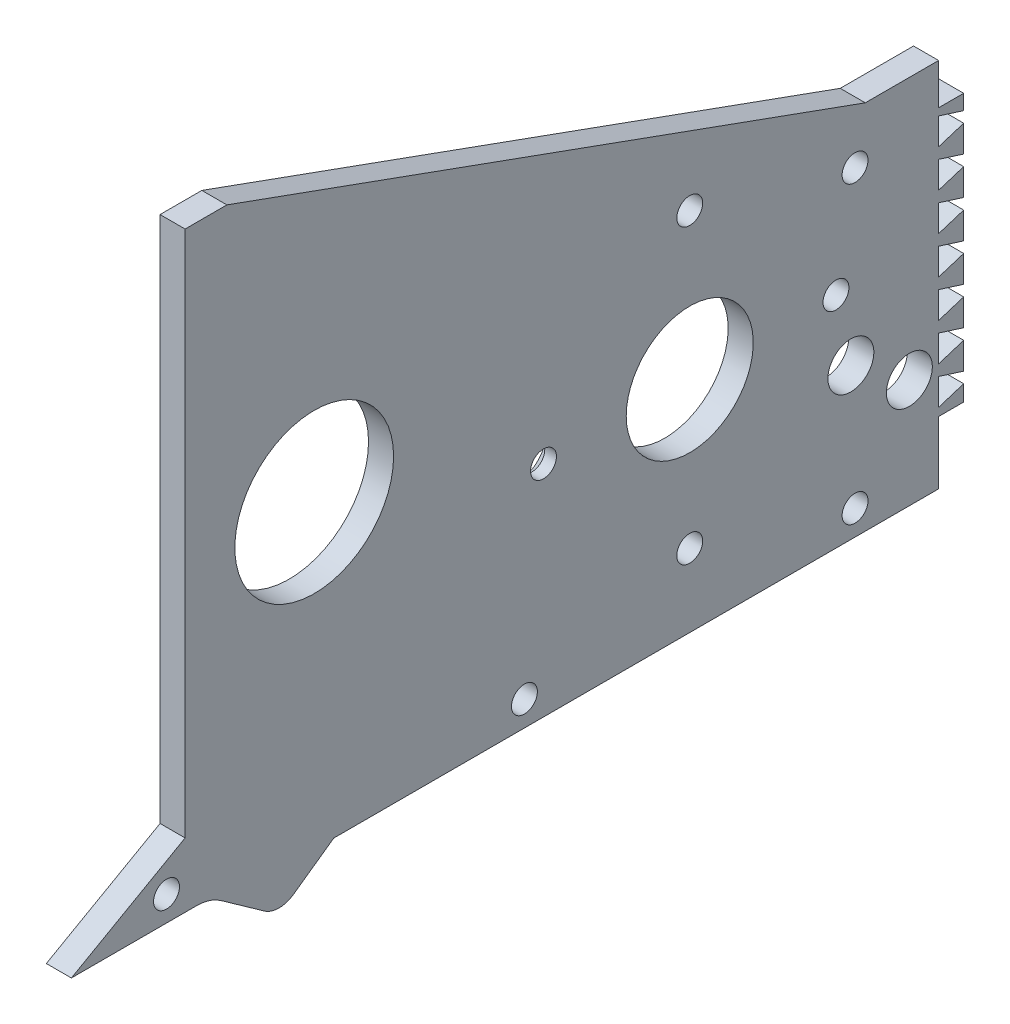
from build123d import *

# Parameters (mm, degrees)
EXTRUDE_1_DEPTH         = 3
SKETCH_3_R              = 7.6
SKETCH_3_R_2            = 9.5
SKETCH_3_R_3            = 1.55
CUT_EXTRUDE_1_DEPTH     = 112.843640856
EXTRUDE_6_DEPTH         = 3
SKETCH_10_R             = 1.55
CUT_EXTRUDE_3_DEPTH     = 124.991771172
CUT_EXTRUDE_6_DEPTH     = 124.991771172
EXTRUDE_7_DEPTH         = 3
CUT_EXTRUDE_7_DEPTH     = 124.991771172
SKETCH_18_W             = 9.7
SKETCH_18_H             = 35
CUT_EXTRUDE_9_DEPTH     = 124.991771172
SKETCH_19_R             = 1.55
CUT_EXTRUDE_10_DEPTH    = 124.991771172
SKETCH_20_W             = 61.573881036
SKETCH_20_H             = 3.2
SKETCH_20_W_2           = 79.598608315
SKETCH_20_H_2           = 1.2
EXTRUDE_8_DEPTH         = 3
EXTRUDE_START           = -3
EXTRUDE_9_DEPTH         = 3
EXTRUDE_11_DEPTH        = 3
SKETCH_25_R             = 9.5
EXTRUDE_12_DEPTH        = 3
SKETCH_26_R             = 9.5
CUT_EXTRUDE_11_DEPTH    = 124.991771172
EXTRUDE_13_DEPTH        = 3
CUT_EXTRUDE_12_DEPTH    = 3
SKETCH_29_W             = 5.5
SKETCH_29_H             = 32
EXTRUDE_14_DEPTH        = 3
SKETCH_32_W             = 9.716106013
SKETCH_32_H             = 6
CUT_EXTRUDE_13_DEPTH    = 124.991771172
CUT_EXTRUDE_16_DEPTH    = 3
SKETCH_35_W             = 2.5
SKETCH_35_H             = 44.4
EXTRUDE_15_DEPTH        = 3
SKETCH_36_R             = 1.55
CUT_EXTRUDE_14794_DEPTH = 3
EXTRUDE_16_DEPTH        = 3
SKETCH_38_R             = 2.75
CUT_EXTRUDE_L_DEPTH     = 121.232106085
SKETCH_41_R             = 1.55
EXTRUDE_17_DEPTH        = 3
CUT_EXTRUDE_17_DEPTH    = 121.232106085


# Read off the part's stored shape, not the designer's step: 高级异型孔1
with BuildPart() as part:
    # 草图1 → 凸台-拉伸1 (new body)
    with BuildSketch(Plane(origin=(0, 0, 0), x_dir=(0, 0, -1), z_dir=(1, 0, 0))):
        Polygon((0, -50), (18.610302832, -39.45792997), (18.610302832, 40), (58.496702951, 40), (58.496702951, 0), (100, 0), (100, -50), align=None)
    extrude(amount=EXTRUDE_1_DEPTH)

    # 草图3 → 切除-拉伸1 (cut, through all)
    with BuildSketch(Plane.ZY):
        with Locations((-74, -24.961577338)):
            Circle(SKETCH_3_R)
        with Locations((-34.176393222, 0)):
            Circle(SKETCH_3_R_2)
        with Locations((-74, -7.461577338)):
            Circle(SKETCH_3_R_3)
        with Locations((-56.5, -24.961577338)):
            Circle(SKETCH_3_R_3)
        with Locations((-74, -42.461577338)):
            Circle(SKETCH_3_R_3)
        with Locations((-91.5, -24.961577338)):
            Circle(SKETCH_3_R_3)
    extrude(amount=-CUT_EXTRUDE_1_DEPTH, mode=Mode.SUBTRACT)

    # 草图6 → 凸台-拉伸6 (add)
    with BuildSketch(Plane.ZY):
        with BuildLine():
            Line((-102.983893987, -45.2), (-110.983893987, -45.2))
            Line((-110.983893987, -45.2), (-111, -50))
            Line((-111, -50), (-100, -50))
            Line((-100, -50), (-100, 0))
            Line((-100, 0), (-110.983893987, 0))
            Line((-110.983893987, 0), (-110.983893987, -6.8))
            Line((-110.983893987, -6.8), (-102.983893987, -6.8))
            ThreePointArc((-102.983893987, -6.8), (-101.283893987, -8.5), (-102.983893987, -10.2))
            Line((-102.983893987, -10.2), (-110.983893987, -10.2))
            Line((-110.983893987, -10.2), (-110.983893987, -41.8))
            Line((-110.983893987, -41.8), (-102.983893987, -41.8))
            ThreePointArc((-102.983893987, -41.8), (-101.283893987, -43.5), (-102.983893987, -45.2))
        make_face()
        with BuildLine():
            Line((-15.00347976, -50), (-34.686448159, -50))
            ThreePointArc((-34.686448159, -50), (-33.16855591, -50.235967767), (-31.793933119, -50.921598751))
            Line((-31.793933119, -50.921598751), (-26.580472983, -54.619128968))
            ThreePointArc((-26.580472983, -54.619128968), (-25.755699309, -55.030507559), (-24.844963959, -55.172088219))
            ThreePointArc((-24.844963959, -55.172088219), (-23.93422861, -55.030507559), (-23.109454935, -54.619128968))
            Line((-23.109454935, -54.619128968), (-17.8959948, -50.921598751))
            ThreePointArc((-17.8959948, -50.921598751), (-16.521372009, -50.235967767), (-15.00347976, -50))
        make_face()
    extrude(amount=-EXTRUDE_6_DEPTH)

    # 草图10 → 切除-拉伸3 (cut, through all)
    with BuildSketch(Plane.ZY):
        with Locations((-105.983893987, -15.2)):
            Circle(SKETCH_10_R)
        with Locations((-105.983893987, -36.8)):
            Circle(SKETCH_10_R)
    extrude(amount=-CUT_EXTRUDE_3_DEPTH, mode=Mode.SUBTRACT)

    # 草图14 → 切除-拉伸6 (cut, through all)
    with BuildSketch(Plane(origin=(3, 0, 0), x_dir=(0, 0, -1), z_dir=(1, 0, 0))):
        with BuildLine():
            Line((58.496702951, 0), (58.496702951, 40))
            Line((58.496702951, 40), (18.610302832, 40))
            Line((18.610302832, 40), (18.610302832, 18.686206016))
            ThreePointArc((18.610302832, 18.686206016), (44.493983197, 22.023278649), (58.496702951, 0))
        make_face()
    extrude(amount=-CUT_EXTRUDE_6_DEPTH, mode=Mode.SUBTRACT)

    # 草图15 → 凸台-拉伸7 (add)
    with BuildSketch(Plane(origin=(3, 0, 0), x_dir=(0, 0, -1), z_dir=(1, 0, 0))):
        with BuildLine():
            Line((18.610302832, 18.686206016), (18.610302832, -18.686206016))
            ThreePointArc((18.610302832, -18.686206016), (9.856083494, 0), (18.610302832, 18.686206016))
        make_face()
    extrude(amount=-EXTRUDE_7_DEPTH)

    # 草图16 → 切除-拉伸7 (cut, through all)
    with BuildSketch(Plane(origin=(3, 0, 0), x_dir=(0, 0, -1), z_dir=(1, 0, 0))):
        with BuildLine():
            Line((18.610302832, -18.686206016), (18.610302832, 0))
            ThreePointArc((18.610302832, 0), (34.176393222, 15.56609039), (49.742483613, 0))
            Line((49.742483613, 0), (58.496702951, 0))
            ThreePointArc((58.496702951, 0), (23.858803248, 22.023278649), (18.610302832, -18.686206016))
        make_face()
    extrude(amount=-CUT_EXTRUDE_7_DEPTH, mode=Mode.SUBTRACT)

    # 草图18 → 切除-拉伸9 (cut, through all)
    with BuildSketch(Plane.ZY):
        with Locations((-106.133893987, -26)):
            Rectangle(SKETCH_18_W, SKETCH_18_H)
    extrude(amount=-CUT_EXTRUDE_9_DEPTH, mode=Mode.SUBTRACT)

    # 草图19 → 切除-拉伸10 (cut, through all)
    with BuildSketch(Plane.ZY):
        with Locations((-105.983893987, -1.8)):
            Circle(SKETCH_19_R)
        with Locations((-105.993932098, -48.2)):
            Circle(SKETCH_19_R)
    extrude(amount=-CUT_EXTRUDE_10_DEPTH, mode=Mode.SUBTRACT)

    # 草图20 → 凸台-拉伸8 (add)
    with BuildSketch(Plane.ZY):
        with Locations((-80.196953469, 1.6)):
            Rectangle(SKETCH_20_W, SKETCH_20_H)
        with Locations((-71.200695842, -50.6)):
            Rectangle(SKETCH_20_W_2, SKETCH_20_H_2)
    extrude(amount=-EXTRUDE_8_DEPTH)

    # 草图22 → 凸台-拉伸9 (add)
    with BuildSketch(Plane.ZY.offset(EXTRUDE_START)):
        with BuildLine():
            Line((-18.610302832, 0), (-18.610302832, 25))
            Line((-18.610302832, 25), (-41.044918155, 13.968769999))
            ThreePointArc((-41.044918155, 13.968769999), (-25.948784515, 13.213993529), (-18.610302832, 0))
        make_face()
    extrude(amount=EXTRUDE_9_DEPTH)

    # 草图24 → 凸台-拉伸11 (add)
    with BuildSketch(Plane.ZY):
        Polygon((-18.610302832, 25), (-70.983893987, 3.2), (-49.410012951, 3.2), align=None)
    extrude(amount=-EXTRUDE_11_DEPTH)

    # 草图25 → 凸台-拉伸12 (add, through all)
    with BuildSketch(Plane(origin=(3, 0, 0), x_dir=(0, 0, -1), z_dir=(1, 0, 0))):
        with Locations((34.176393222, 0)):
            Circle(SKETCH_25_R)
    extrude(amount=-EXTRUDE_12_DEPTH)

    # 草图26 → 切除-拉伸11 (cut, through all)
    with BuildSketch(Plane(origin=(3, 0, 0), x_dir=(0, 0, -1), z_dir=(1, 0, 0))):
        with Locations((29.059828781, -15.2)):
            Circle(SKETCH_26_R)
    extrude(amount=-CUT_EXTRUDE_11_DEPTH, mode=Mode.SUBTRACT)

    # 草图27 → 凸台-拉伸13 (add)
    with BuildSketch(Plane.ZY):
        Polygon((-18.610302832, -10.2), (-13.610302832, -15.2), (-18.610302832, -20.2), align=None)
    extrude(amount=-EXTRUDE_13_DEPTH)

    # 草图28 → 切除-拉伸12 (cut)
    with BuildSketch(Plane.ZY):
        Polygon((-110.983893987, 3.2), (-101.283893987, 3.2), (-70.983893987, 3.2), (-95.008477086, -6.8), (-101.283893987, -6.8), (-101.283893987, -45.2), (-110.983893987, -45.2), align=None)
    extrude(amount=-CUT_EXTRUDE_12_DEPTH, mode=Mode.SUBTRACT)

    # 草图29 → 凸台-拉伸14 (add)
    with BuildSketch(Plane.ZY):
        with Locations((-104.033893987, -27.7)):
            Rectangle(SKETCH_29_W, SKETCH_29_H)
    extrude(amount=-EXTRUDE_14_DEPTH)

    # 草图32 → 切除-拉伸13 (cut, through all)
    with BuildSketch(Plane.ZY):
        with Locations((-106.141946993, -48.2)):
            Rectangle(SKETCH_32_W, SKETCH_32_H)
    extrude(amount=-CUT_EXTRUDE_13_DEPTH, mode=Mode.SUBTRACT)

    # 草图34 → 切除-拉伸16 (cut)
    with BuildSketch(Plane.ZY):
        Polygon((-103.783893987, -15.75), (-103.783893987, -12.55), (-106.783893987, -13.5), (-106.783893987, -14.8), align=None)
        Polygon((-106.783893987, -18), (-106.783893987, -19.3), (-103.783893987, -20.25), (-103.783893987, -17.05), align=None)
        Polygon((-106.783893987, -22.5), (-106.783893987, -23.8), (-103.783893987, -24.75), (-103.783893987, -21.55), align=None)
        Polygon((-106.783893987, -27), (-106.783893987, -28.3), (-103.783893987, -29.25), (-103.783893987, -26.05), align=None)
        Polygon((-106.783893987, -31.5), (-106.783893987, -32.8), (-103.783893987, -33.75), (-103.783893987, -30.55), align=None)
        Polygon((-106.783893987, -36), (-106.783893987, -37.3), (-103.783893987, -38.25), (-103.783893987, -35.05), align=None)
        Polygon((-106.783893987, -40.5), (-106.783893987, -41.8), (-103.783893987, -42.75), (-103.783893987, -39.55), align=None)
    extrude(amount=-CUT_EXTRUDE_16_DEPTH, mode=Mode.SUBTRACT)

    # 草图35 → 凸台-拉伸15 (add, through all)
    with BuildSketch(Plane.ZY):
        with Locations((-102.533893987, -29)):
            Rectangle(SKETCH_35_W, SKETCH_35_H)
    extrude(amount=-EXTRUDE_15_DEPTH)

    # 草图36 → Cut-Extrude 14794 (cut)
    with BuildSketch(Plane.ZY):
        with Locations((-93.783893987, -48.2)):
            Circle(SKETCH_36_R)
        with Locations(Location((-93.783893987, -12.9, 0), (0, 0, 180))):
            Circle(SKETCH_36_R)
        with Locations((-21.610302832, 20.501770791)):
            Circle(SKETCH_36_R)
        with Locations((-11.382694019, -47)):
            Circle(SKETCH_36_R)
        with Locations(Location((-54.216106013, -48.2, 0), (0, 0, 180))):
            Circle(SKETCH_36_R)
    extrude(amount=-CUT_EXTRUDE_14794_DEPTH, mode=Mode.SUBTRACT)

    # 草图37 → 凸台-拉伸16 (add)
    with BuildSketch(Plane.ZY):
        Polygon((-13.610302832, -39.45792997), (-13.610302832, -42.290250896), (-18.610302832, -39.45792997), (-18.610302832, 25), (-13.610302832, 25), align=None)
    extrude(amount=-EXTRUDE_16_DEPTH)

    # 草图38 → L型支架定位孔 (cut, through all)
    with BuildSketch(Plane(origin=(3, 0, 0), x_dir=(0, 0, -1), z_dir=(1, 0, 0))):
        with Locations((100.283893987, -38.15)):
            Circle(SKETCH_38_R)
        with Locations((93.283893987, -33.15)):
            Circle(SKETCH_38_R)
    extrude(amount=-CUT_EXTRUDE_L_DEPTH, mode=Mode.SUBTRACT)

    # 高级异型孔1 outline → 高级异型孔1 (revolve, cut)
    with BuildSketch(Plane(origin=(0, -24.961577338, -56.5), x_dir=(0, 1, 0), z_dir=(0, 0, -1))):
        Polygon((1.7, 1.6), (1.55, 1.6), (1.55, 0), (3.3, 0), align=None)
    revolve(axis=Axis((0, -24.961577338, -56.5), (1, 0, 0)), mode=Mode.SUBTRACT)

    # 草图41 → 凸台-拉伸17 (add, through all)
    with BuildSketch(Plane.ZY):
        with Locations((-21.610302832, 20.501770791)):
            Circle(SKETCH_41_R)
    extrude(amount=-EXTRUDE_17_DEPTH)

    # 草图42 → 切除-拉伸17 (cut, through all)
    with BuildSketch(Plane.ZY):
        Polygon((-95.008477086, -6.8), (-18.610302832, 20.82), (-13.610302832, 20.82), (-13.610302832, 25), (-18.610302832, 25), align=None)
    extrude(amount=-CUT_EXTRUDE_17_DEPTH, mode=Mode.SUBTRACT)


solid = part.part
